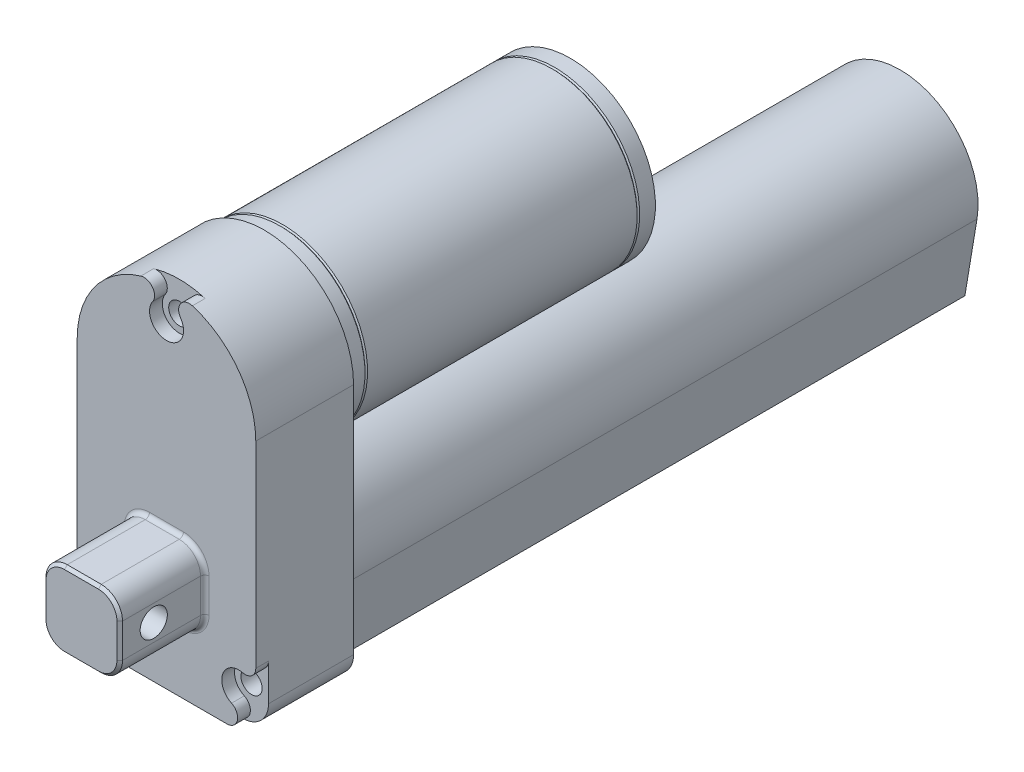
from build123d import *

# Parameters (mm, degrees)
BOSS_EXTRUDE1_DEPTH            = 23
CUT_EXTRUDE1_DEPTH             = 3
CUT_EXTRUDE2_DEPTH             = 3
CUT_EXTRUDE3_DEPTH             = 3
SKETCH5_W                      = 18
SKETCH5_H                      = 18
BOSS_EXTRUDE2_DEPTH            = 20
BOSS_EXTRUDE3_DEPTH            = 149.7
SKETCH8_W                      = 10
SKETCH8_H                      = 138
F_5_0_5_DIAMETER_HOLE1_D       = 5
F_5_0_5_DIAMETER_HOLE1_DEPTH   = 20
F_6_4_6_4_DIAMETER_HOLE1_D     = 6.4
F_6_4_6_4_DIAMETER_HOLE1_DEPTH = 30
FILLET1_R                      = 5
CHAMFER1_SIZE                  = 0.657
FILLET2_R                      = 0.5
FILLET3_R                      = 1
FILLET4_R                      = 1.5
FILLET5_START                  = -35.454500108
FILLET5_DEPTH                  = 4.454500108
FILLET6_R                      = 6
SKETCH19_R                     = 10
CUT_EXTRUDE4_DEPTH             = 30
SCALE1_SCALE                   = 0.5


with BuildPart() as part:
    # Sketch1 → Boss-Extrude1 (new body)
    with BuildSketch(Plane.XY.offset(-32.454500108)):
        with BuildLine():
            Line((13.42953052, -65.776710579), (55.42953052, -65.776710579))
            Line((55.42953052, -65.776710579), (55.42953052, -4.776710579))
            ThreePointArc((55.42953052, -4.776710579), (34.42953052, 16.223289421), (13.42953052, -4.776710579))
            Line((13.42953052, -4.776710579), (13.42953052, -65.776710579))
        make_face()
    extrude(amount=-BOSS_EXTRUDE1_DEPTH)

    # Sketch2 → Cut-Extrude1 (cut)
    with BuildSketch(Plane.XY.offset(-32.454500108)):
        with BuildLine():
            Line((13.42953052, -57.351010373), (13.42953052, -65.776710579))
            Line((13.42953052, -65.776710579), (20.100874204, -65.776710579))
            ThreePointArc((20.100874204, -65.776710579), (17.656719067, -63.802168161), (19.073434325, -60.997595115))
            ThreePointArc((19.073434325, -60.997595115), (19.600289003, -53.991277109), (13.42953052, -57.351010373))
        make_face()
    extrude(amount=-CUT_EXTRUDE1_DEPTH, mode=Mode.SUBTRACT)

    # Sketch3 → Cut-Extrude2 (cut)
    with BuildSketch(Plane.XY.offset(-32.454500108)):
        with BuildLine():
            Line((55.42953052, -65.776710579), (55.42953052, -57.394966506))
            ThreePointArc((55.42953052, -57.394966506), (49.285998633, -54.017797418), (49.726894996, -61.01450132))
            ThreePointArc((49.726894996, -61.01450132), (51.102575978, -63.821906348), (48.662747793, -65.776710579))
            Line((48.662747793, -65.776710579), (55.42953052, -65.776710579))
        make_face()
    extrude(amount=-CUT_EXTRUDE2_DEPTH, mode=Mode.SUBTRACT)

    # Sketch4 → Cut-Extrude3 (cut)
    with BuildSketch(Plane.XY.offset(-32.454500108)):
        with BuildLine():
            ThreePointArc((28.400368742, 15.33918384), (31.143729281, 14.409675692), (31.167916073, 11.513224857))
            ThreePointArc((31.167916073, 11.513224857), (34.442423035, 5.223292745), (37.733137686, 11.504760638))
            ThreePointArc((37.733137686, 11.504760638), (37.764792889, 14.401139479), (40.510541043, 15.323570788))
            ThreePointArc((40.510541043, 15.323570788), (34.456604769, 16.223271968), (28.400368742, 15.33918384))
        make_face()
    extrude(amount=-CUT_EXTRUDE3_DEPTH, mode=Mode.SUBTRACT)

    # Sketch5 → Boss-Extrude2 (add)
    with BuildSketch(Plane.XY.offset(-32.454500108)):
        with Locations((34.42953052, -41.776710579)):
            Rectangle(SKETCH5_W, SKETCH5_H)
    extrude(amount=BOSS_EXTRUDE2_DEPTH)

    # Sketch6 → Boss-Extrude3 (add)
    with BuildSketch(Plane(origin=(0, 0, -55.454500108), x_dir=(-1, 0, 0), z_dir=(0, 0, -1))):
        with BuildLine():
            Line((-16.172658971, -47.421015636), (-19.022097723, -64.486635224))
            Line((-19.022097723, -64.486635224), (-49.522097723, -64.486635224))
            Line((-49.522097723, -64.486635224), (-52.371536476, -47.421015636))
            ThreePointArc((-52.371536476, -47.421015636), (-34.272097723, -26.048960567), (-16.172658971, -47.421015636))
        make_face()
    extrude(amount=BOSS_EXTRUDE3_DEPTH)

    # Sketch7 → Revolve1 (revolve)
    with BuildSketch(Plane.XZ.offset(4.776710579), mode=Mode.PRIVATE) as revolve1_sk:
        Polygon((54.42953052, -55.454500108), (34.42953052, -55.454500108), (34.42953052, -131.454500108), (41.92953052, -131.454500108), (41.92953052, -127.454500108), (54.42953052, -127.454500108), (54.42953052, -123.754500108), (54.12953052, -123.454500108), (54.42953052, -123.154500108), (54.42953052, -59.754500108), (54.12953052, -59.454500108), (54.42953052, -59.154500108), align=None)
    revolve(revolve1_sk.sketch.rotate(Axis((34.42953052, -4.776710579, -55.454500108), (0, 0, -1)), 180), axis=Axis((34.42953052, -4.776710579, -55.454500108), (0, 0, -1)))

    # Sketch8 → Cut-Revolve1 (revolve, cut)
    with BuildSketch(Plane(origin=(0, -44.398960567, 0), x_dir=(1, 0, 0), z_dir=(0, 1, 0))):
        with Locations((39.272097723, 116.154500108)):
            Rectangle(SKETCH8_W, SKETCH8_H)
    revolve(axis=Axis((34.272097723, -44.398960567, -185.154500108), (0, 0, 1)), mode=Mode.SUBTRACT)

    # Ø5.0 (5) Diameter Hole1
    with Locations(Plane.XY.offset(-35.454500108)):
        with Locations((34.447580034, 9.223289421), (17.42953052, -57.351010373), (51.42953052, -57.394966506)):
            Hole(F_5_0_5_DIAMETER_HOLE1_D / 2, depth=F_5_0_5_DIAMETER_HOLE1_DEPTH)

    # Ø6.4 (6.4) Diameter Hole1
    with Locations(Plane(origin=(43.42953052, 0, 0), x_dir=(0, 0, -1), z_dir=(1, 0, 0))):
        with Locations((20.454500108, -41.749998068)):
            Hole(F_6_4_6_4_DIAMETER_HOLE1_D / 2, depth=F_6_4_6_4_DIAMETER_HOLE1_DEPTH)

    # Fillet1
    fillet1_edges = [part.edges().sort_by_distance(p)[0] for p in [
        (25.42953052, -32.776710579, -22.454500108),
        (25.42953052, -50.776710579, -22.454500108),
        (43.42953052, -50.776710579, -22.454500108),
        (43.42953052, -32.776710579, -22.454500108),
    ]]
    fillet(fillet1_edges, radius=FILLET1_R)

    # Chamfer1
    chamfer1_edges = [part.edges().sort_by_distance(p)[0] for p in [
        (25.42953052, -41.776710579, -12.454500108),
        (34.42953052, -32.776710579, -12.454500108),
        (34.42953052, -50.776710579, -12.454500108),
        (43.42953052, -41.776710579, -12.454500108),
        (41.965064426, -34.241176673, -12.454500108),
        (26.893996615, -49.312244485, -12.454500108),
        (41.965064426, -49.312244485, -12.454500108),
        (26.893996615, -34.241176673, -12.454500108),
    ]]
    chamfer(chamfer1_edges, length=CHAMFER1_SIZE)

    # Fillet2
    fillet2_edges = [part.edges().sort_by_distance(p)[0] for p in [
        (41.92953052, -4.776710579, -127.454500108),
        (24.272097723, -44.398960567, -185.154500108),
    ]]
    fillet(fillet2_edges, radius=FILLET2_R)

    # Fillet3
    fillet3_edges = [part.edges().sort_by_distance(p)[0] for p in [
        (25.42953052, -41.776710579, -32.454500108),
        (34.42953052, -32.776710579, -32.454500108),
        (43.42953052, -41.776710579, -32.454500108),
        (34.42953052, -50.776710579, -32.454500108),
        (26.893996615, -34.241176673, -32.454500108),
        (41.965064426, -49.312244485, -32.454500108),
        (26.893996615, -49.312244485, -32.454500108),
        (41.965064426, -34.241176673, -32.454500108),
    ]]
    fillet(fillet3_edges, radius=FILLET3_R)

    # Fillet4
    fillet4_edges = [part.edges().sort_by_distance(p)[0] for p in [
        (41.92953052, -4.776710579, -131.454500108),
    ]]
    fillet(fillet4_edges, radius=FILLET4_R)

    # Fillet5: read off the stored shape, not the designer's step
    # Fillet5 outline → Fillet5 (cut)
    with BuildSketch(Plane.XY.offset(FILLET5_START)):
        with BuildLine():
            ThreePointArc((16.506453597, -53.45897633), (14.379096338, -52.987616404), (13.42953052, -51.026455053))
            Line((13.42953052, -51.026455053), (13.42953052, -57.351010373))
            ThreePointArc((13.42953052, -57.351010373), (14.291672358, -54.870315681), (16.506453597, -53.45897633))
        make_face()
        with BuildLine():
            ThreePointArc((55.42953052, -51.070411186), (54.479964703, -53.031572537), (52.352607444, -53.502932463))
            ThreePointArc((52.352607444, -53.502932463), (54.567388683, -54.914271815), (55.42953052, -57.394966506))
            Line((55.42953052, -57.394966506), (55.42953052, -51.070411186))
        make_face()
    extrude(amount=FILLET5_DEPTH, mode=Mode.SUBTRACT)

    # Fillet6
    fillet6_edges = [part.edges().sort_by_distance(p)[0] for p in [
        (55.42953052, -65.776710579, -45.454500108),
        (13.42953052, -65.776710579, -45.454500108),
    ]]
    fillet(fillet6_edges, radius=FILLET6_R)

    # Sketch19 → Cut-Extrude4 (cut)
    with BuildSketch(Plane(origin=(0, 0, -205.154500108), x_dir=(-1, 0, 0), z_dir=(0, 0, -1))):
        with Locations(Location((-34.272097723, -44.398960567, 0), (0, 0, 180))):
            Circle(SKETCH19_R)
    extrude(amount=-CUT_EXTRUDE4_DEPTH, mode=Mode.SUBTRACT)


with BuildPart() as part_1:
    # Scale1: scaled about (34.360705618, -29.246210069, -96.472143376)
    add(part.part.scale(SCALE1_SCALE).moved(Location((17.180352809, -14.623105034, -48.236071688))))


solid = part_1.part
